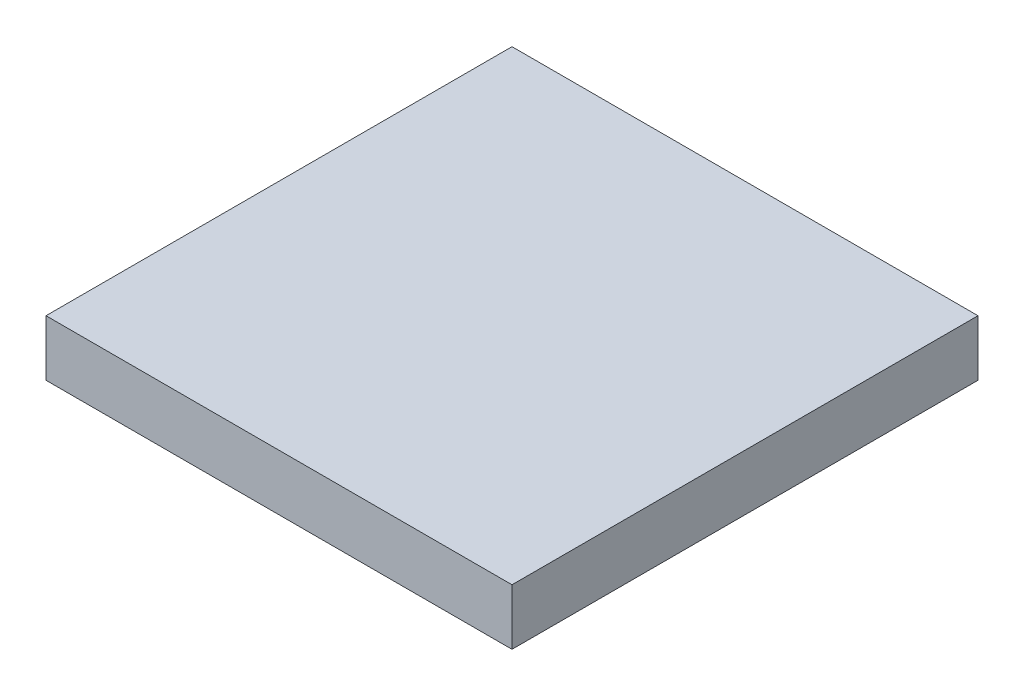
from build123d import *

# Parameters (mm, degrees)
SKETCH1_W           = 25
SKETCH1_H           = 25
BOSS_EXTRUDE1_DEPTH = 3
CAVITY1_OUTLINE_R   = 10
CAVITY1_OUTLINE_R_2 = 5.5
CAVITY1_DEPTH       = 2
SKETCH2_R           = 1.25
CUT_EXTRUDE1_DEPTH  = 2


# Read off the part's stored shape, not the designer's step: Cavity1
with BuildPart() as part:
    # Sketch1 → Boss-Extrude1 (new body)
    with BuildSketch(Plane(origin=(0, 0, 0), x_dir=(1, 0, 0), z_dir=(0, 1, 0))):
        Rectangle(SKETCH1_W, SKETCH1_H)
    extrude(amount=BOSS_EXTRUDE1_DEPTH)

    # Cavity1 outline → Cavity1 (cut)
    with BuildSketch(Plane(origin=(0, 0, 0), x_dir=(1, 0, 0), z_dir=(0, 1, 0))):
        Circle(CAVITY1_OUTLINE_R)
        Circle(CAVITY1_OUTLINE_R_2, mode=Mode.SUBTRACT)
    extrude(amount=CAVITY1_DEPTH, mode=Mode.SUBTRACT)

    # Sketch2 → Cut-Extrude1 (cut)
    with BuildSketch(Plane.XZ):
        with Locations(Location((-10.5, 10.5, 0), (0, 0, 270))):
            Circle(SKETCH2_R)
        with Locations(Location((10.5, 10.5, 0), (0, 0, 270))):
            Circle(SKETCH2_R)
        with Locations(Location((10.5, -10.5, 0), (0, 0, 270))):
            Circle(SKETCH2_R)
        with Locations(Location((-10.5, -10.5, 0), (0, 0, 270))):
            Circle(SKETCH2_R)
    extrude(amount=-CUT_EXTRUDE1_DEPTH, mode=Mode.SUBTRACT)


solid = part.part
